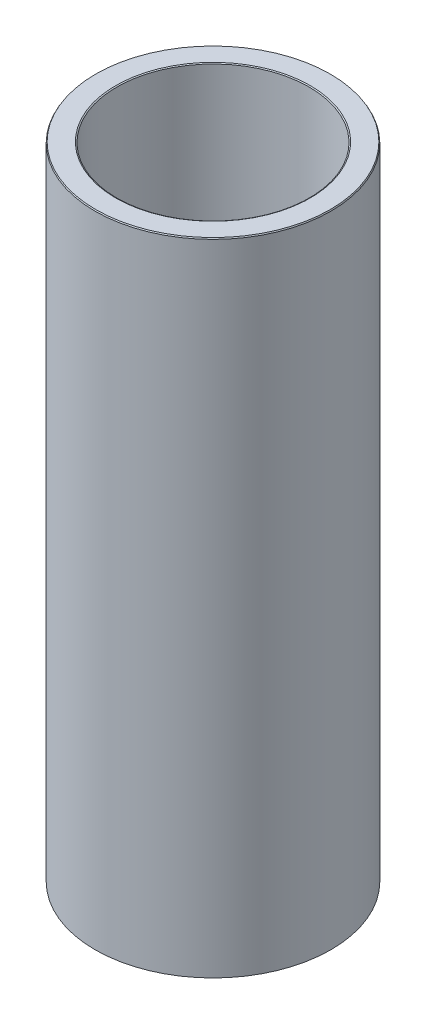
from build123d import *
from OCP.BRepFilletAPI import BRepFilletAPI_MakeChamfer

# Parameters (mm, degrees)
SKETCH1_R           = 30
BOSS_EXTRUDE1_DEPTH = 163.122701216
SKETCH2_R           = 24.466778712
CUT_EXTRUDE1_DEPTH  = 169.549742367
CHAMFER1_SIZE       = 0.287428342
CHAMFER1_SIZE2      = 0.165946831


with BuildPart() as part:
    # Sketch1 → Boss-Extrude1 (new body)
    with BuildSketch(Plane(origin=(0, 0, 0), x_dir=(1, 0, 0), z_dir=(0, 1, 0))):
        Circle(SKETCH1_R)
    extrude(amount=BOSS_EXTRUDE1_DEPTH)

    # Sketch2 → Cut-Extrude1 (cut, through all)
    with BuildSketch(Plane(origin=(0, 0, 0), x_dir=(1, 0, 0), z_dir=(0, 1, 0))):
        Circle(SKETCH2_R)
    extrude(amount=CUT_EXTRUDE1_DEPTH, mode=Mode.SUBTRACT)

    # Chamfer1: one chamfer whose edges measure the first distance from different faces: ONE call of the kernel's chamfer builder (chamfer() names one face for all edges)
    chamfer1_edges_1 = [part.edges().sort_by_distance(p)[0] for p in [
        (-24.466778712, 163.122701216, 0),
    ]]
    chamfer1_side_1 = [part.faces().sort_by_distance(p)[0] for p in [
        (-29.151471863, 163.122701216, 0),
    ]]
    chamfer1_edges_2 = [part.edges().sort_by_distance(p)[0] for p in [
        (-24.466778712, 0, 0),
    ]]
    chamfer1_side_2 = [part.faces().sort_by_distance(p)[0] for p in [
        (-24.466778712, 81.561350608, 0),
    ]]
    chamfer1_edges_3 = [part.edges().sort_by_distance(p)[0] for p in [
        (-30, 0, 0),
    ]]
    chamfer1_side_3 = [part.faces().sort_by_distance(p)[0] for p in [
        (-29.151471863, 0, 0),
    ]]
    chamfer1_edges_4 = [part.edges().sort_by_distance(p)[0] for p in [
        (-30, 163.122701216, 0),
    ]]
    chamfer1_side_4 = [part.faces().sort_by_distance(p)[0] for p in [
        (-30, 81.561350608, 0),
    ]]
    chamfer1 = BRepFilletAPI_MakeChamfer(part.part.solid().wrapped)
    for e in chamfer1_edges_1:
        chamfer1.Add(CHAMFER1_SIZE, CHAMFER1_SIZE2, e.wrapped, chamfer1_side_1[0].wrapped)  # the first distance lies on this face
    for e in chamfer1_edges_2:
        chamfer1.Add(CHAMFER1_SIZE, CHAMFER1_SIZE2, e.wrapped, chamfer1_side_2[0].wrapped)  # the first distance lies on this face
    for e in chamfer1_edges_3:
        chamfer1.Add(CHAMFER1_SIZE, CHAMFER1_SIZE2, e.wrapped, chamfer1_side_3[0].wrapped)  # the first distance lies on this face
    for e in chamfer1_edges_4:
        chamfer1.Add(CHAMFER1_SIZE, CHAMFER1_SIZE2, e.wrapped, chamfer1_side_4[0].wrapped)  # the first distance lies on this face
    add(Compound.cast(chamfer1.Shape()), mode=Mode.REPLACE)


solid = part.part
